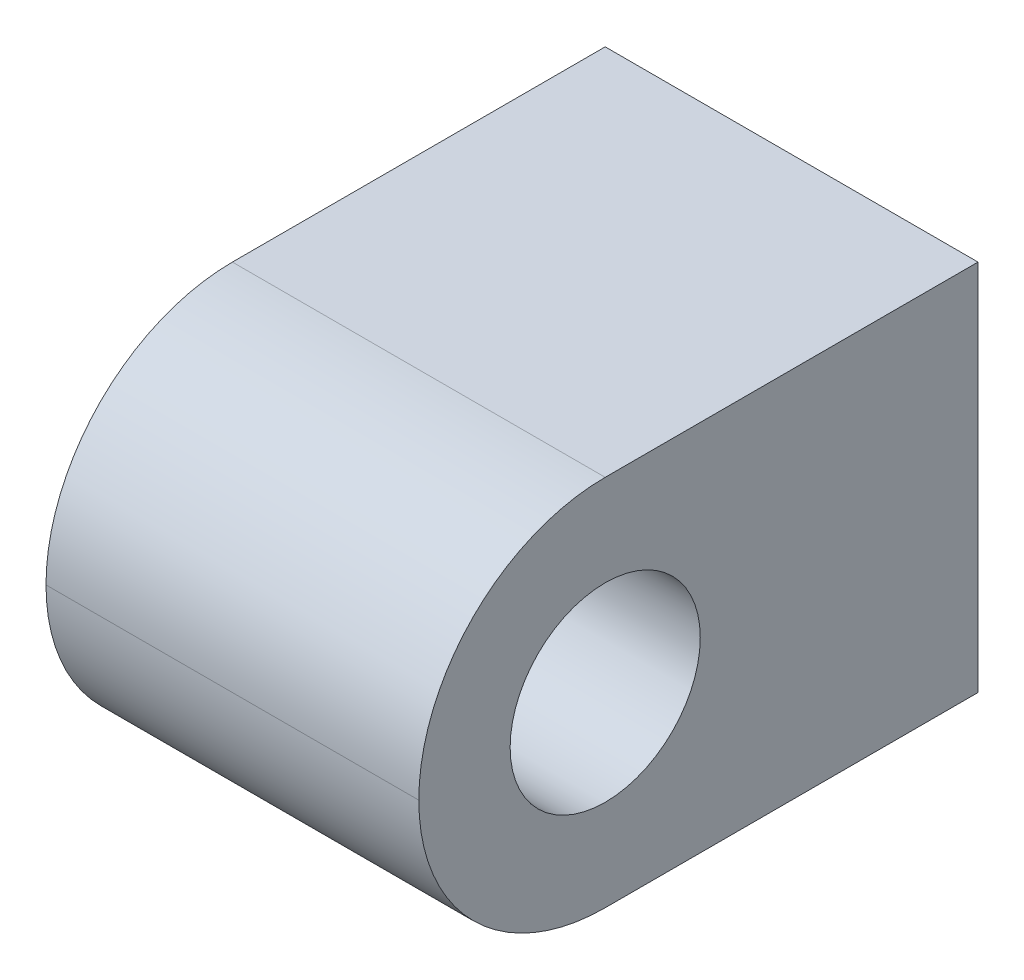
from build123d import *

# Parameters (mm, degrees)
SKETCH1_W           = 10
SKETCH1_H           = 10
SKETCH1_R           = 2.475
BOSS_EXTRUDE2_DEPTH = 15
SKETCH2_R           = 2.55
CUT_EXTRUDE1_DEPTH  = 10
FILLET1_R           = 5
SKETCH1_5_R         = 2.475
CUT_EXTRUDE2_DEPTH  = 7


with BuildPart() as part:
    # Sketch1 → Boss-Extrude2 (new body)
    # profile 1 of 2: a face of its own
    with BuildSketch(Plane.XY):
        Rectangle(SKETCH1_W, SKETCH1_H)
        Circle(SKETCH1_R, mode=Mode.SUBTRACT)
    # profile 2 of 2: a face of its own
    with BuildSketch(Plane.XY):
        Circle(SKETCH1_R)
    extrude(amount=BOSS_EXTRUDE2_DEPTH)

    # Sketch2 → Cut-Extrude1 (cut)
    with BuildSketch(Plane.ZY.offset(5)):
        with Locations((10, 0)):
            Circle(SKETCH2_R)
    extrude(amount=-CUT_EXTRUDE1_DEPTH, mode=Mode.SUBTRACT)

    # Fillet1
    fillet1_edges = [part.edges().sort_by_distance(p)[0] for p in [
        (0, -5, 15),
        (0, 5, 15),
    ]]
    fillet(fillet1_edges, radius=FILLET1_R - 0.0001)  # a hair under: the kernel refuses the full size

    # Sketch1<5> → Cut-Extrude2 (cut)
    with BuildSketch(Plane.XY):
        Circle(SKETCH1_5_R)
    extrude(amount=CUT_EXTRUDE2_DEPTH, mode=Mode.SUBTRACT)


solid = part.part
